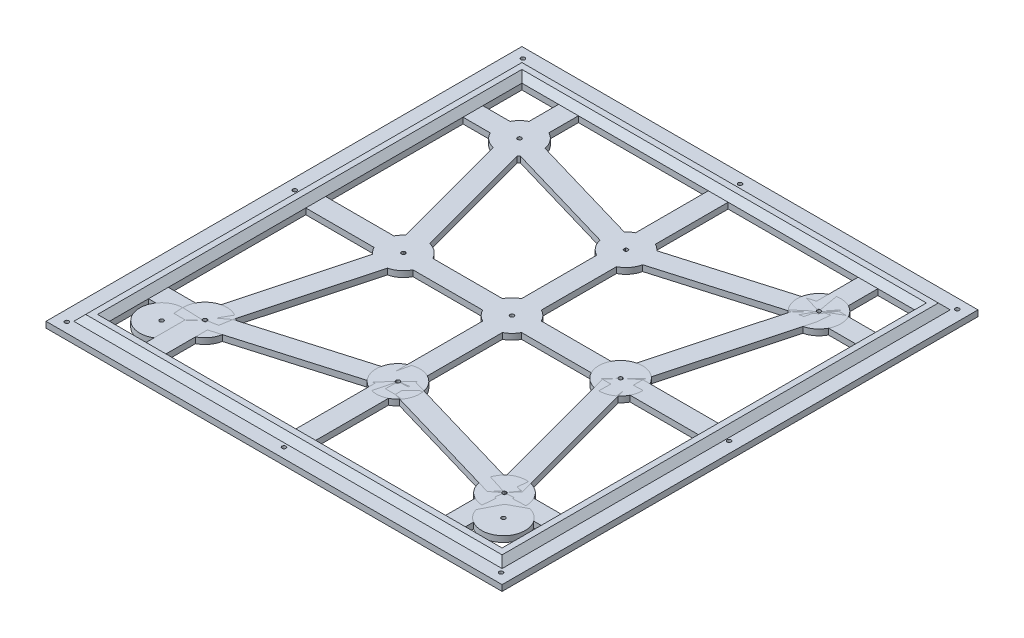
from build123d import *

# Parameters (mm, degrees)
SKETCH1_W           = 230
SKETCH1_H           = 240
BOSS_EXTRUDE1_DEPTH = 3
CUT_EXTRUDE1_REACH  = 168.235
SKETCH2_R           = 1
SKETCH4_W           = 210
SKETCH4_H           = 220
SKETCH4_W_2         = 204
SKETCH4_H_2         = 214
BOSS_EXTRUDE2_DEPTH = 3
CHAMFER1_SIZE       = 3
CUT_EXTRUDE2_REACH  = 168.235
SKETCH5_W           = 198
SKETCH5_H           = 208
SKETCH5_R           = 11
SKETCH6_W           = 43.25
SKETCH6_H           = 10
SKETCH6_W_2         = 10
SKETCH6_H_2         = 55.5
SKETCH6_W_3         = 22.491368523
SKETCH6_H_3         = 23.698697536
SKETCH6_W_4         = 52.75
SKETCH6_H_4         = 45.5
EXTRUDE_THIN2_DEPTH = 3


with BuildPart() as part:
    # Sketch1 → Boss-Extrude1 (new body)
    with BuildSketch(Plane(origin=(0, 0, 0), x_dir=(1, 0, 0), z_dir=(0, 1, 0))):
        Rectangle(SKETCH1_W, SKETCH1_H)
    extrude(amount=BOSS_EXTRUDE1_DEPTH)

    # Sketch2 → Cut-Extrude1 (cut, up to next)
    with BuildSketch(Plane(origin=(0, 3, 0), x_dir=(1, 0, 0), z_dir=(0, 1, 0)), mode=Mode.PRIVATE) as cut_extrude1_sk1:
        with Locations(Location((-109.5, -115, 0), (0, 0, 270))):
            Circle(SKETCH2_R)
    cut_extrude1_tool1 = extrude(cut_extrude1_sk1.sketch, amount=-CUT_EXTRUDE1_REACH, mode=Mode.PRIVATE) & part.part
    # Sketch2 → Cut-Extrude1 (cut, up to next)
    with BuildSketch(Plane(origin=(0, 3, 0), x_dir=(1, 0, 0), z_dir=(0, 1, 0)), mode=Mode.PRIVATE) as cut_extrude1_sk2:
        with Locations(Location((109.5, -115, 0), (0, 0, 270))):
            Circle(SKETCH2_R)
    cut_extrude1_tool2 = extrude(cut_extrude1_sk2.sketch, amount=-CUT_EXTRUDE1_REACH, mode=Mode.PRIVATE) & part.part
    # Sketch2 → Cut-Extrude1 (cut, up to next)
    with BuildSketch(Plane(origin=(0, 3, 0), x_dir=(1, 0, 0), z_dir=(0, 1, 0)), mode=Mode.PRIVATE) as cut_extrude1_sk3:
        with Locations(Location((0, -115, 0), (0, 0, 270))):
            Circle(SKETCH2_R)
    cut_extrude1_tool3 = extrude(cut_extrude1_sk3.sketch, amount=-CUT_EXTRUDE1_REACH, mode=Mode.PRIVATE) & part.part
    # Sketch2 → Cut-Extrude1 (cut, up to next)
    with BuildSketch(Plane(origin=(0, 3, 0), x_dir=(1, 0, 0), z_dir=(0, 1, 0)), mode=Mode.PRIVATE) as cut_extrude1_sk4:
        with Locations(Location((-86.197067896, -90.526600986, 0), (0, 0, 270))):
            Circle(SKETCH2_R)
    cut_extrude1_tool4 = extrude(cut_extrude1_sk4.sketch, amount=-CUT_EXTRUDE1_REACH, mode=Mode.PRIVATE) & part.part
    # Sketch2 → Cut-Extrude1 (cut, up to next)
    with BuildSketch(Plane(origin=(0, 3, 0), x_dir=(1, 0, 0), z_dir=(0, 1, 0)), mode=Mode.PRIVATE) as cut_extrude1_sk5:
        with Locations(Location((86.197067896, -90.526600986, 0), (0, 0, 270))):
            Circle(SKETCH2_R)
    cut_extrude1_tool5 = extrude(cut_extrude1_sk5.sketch, amount=-CUT_EXTRUDE1_REACH, mode=Mode.PRIVATE) & part.part
    # Sketch2 → Cut-Extrude1 (cut, up to next)
    with BuildSketch(Plane(origin=(0, 3, 0), x_dir=(1, 0, 0), z_dir=(0, 1, 0)), mode=Mode.PRIVATE) as cut_extrude1_sk6:
        with Locations(Location((0, 0, 0), (0, 0, 270))):
            Circle(SKETCH2_R)
    cut_extrude1_tool6 = extrude(cut_extrude1_sk6.sketch, amount=-CUT_EXTRUDE1_REACH, mode=Mode.PRIVATE) & part.part
    # Sketch2 → Cut-Extrude1 (cut, up to next)
    with BuildSketch(Plane(origin=(0, 3, 0), x_dir=(1, 0, 0), z_dir=(0, 1, 0)), mode=Mode.PRIVATE) as cut_extrude1_sk7:
        with Locations(Location((-109.5, 0, 0), (0, 0, 270))):
            Circle(SKETCH2_R)
    cut_extrude1_tool7 = extrude(cut_extrude1_sk7.sketch, amount=-CUT_EXTRUDE1_REACH, mode=Mode.PRIVATE) & part.part
    # Sketch2 → Cut-Extrude1 (cut, up to next)
    with BuildSketch(Plane(origin=(0, 3, 0), x_dir=(1, 0, 0), z_dir=(0, 1, 0)), mode=Mode.PRIVATE) as cut_extrude1_sk8:
        with Locations(Location((-109.5, 115, 0), (0, 0, 270))):
            Circle(SKETCH2_R)
    cut_extrude1_tool8 = extrude(cut_extrude1_sk8.sketch, amount=-CUT_EXTRUDE1_REACH, mode=Mode.PRIVATE) & part.part
    # Sketch2 → Cut-Extrude1 (cut, up to next)
    with BuildSketch(Plane(origin=(0, 3, 0), x_dir=(1, 0, 0), z_dir=(0, 1, 0)), mode=Mode.PRIVATE) as cut_extrude1_sk9:
        with Locations(Location((-75.508631477, 79.301302464, 0), (0, 0, 270))):
            Circle(SKETCH2_R)
    cut_extrude1_tool9 = extrude(cut_extrude1_sk9.sketch, amount=-CUT_EXTRUDE1_REACH, mode=Mode.PRIVATE) & part.part
    # Sketch2 → Cut-Extrude1 (cut, up to next)
    with BuildSketch(Plane(origin=(0, 3, 0), x_dir=(1, 0, 0), z_dir=(0, 1, 0)), mode=Mode.PRIVATE) as cut_extrude1_sk10:
        with Locations(Location((75.508631477, 79.301302464, 0), (0, 0, 270))):
            Circle(SKETCH2_R)
    cut_extrude1_tool10 = extrude(cut_extrude1_sk10.sketch, amount=-CUT_EXTRUDE1_REACH, mode=Mode.PRIVATE) & part.part
    # Sketch2 → Cut-Extrude1 (cut, up to next)
    with BuildSketch(Plane(origin=(0, 3, 0), x_dir=(1, 0, 0), z_dir=(0, 1, 0)), mode=Mode.PRIVATE) as cut_extrude1_sk11:
        with Locations(Location((0, 115, 0), (0, 0, 270))):
            Circle(SKETCH2_R)
    cut_extrude1_tool11 = extrude(cut_extrude1_sk11.sketch, amount=-CUT_EXTRUDE1_REACH, mode=Mode.PRIVATE) & part.part
    # Sketch2 → Cut-Extrude1 (cut, up to next)
    with BuildSketch(Plane(origin=(0, 3, 0), x_dir=(1, 0, 0), z_dir=(0, 1, 0)), mode=Mode.PRIVATE) as cut_extrude1_sk12:
        with Locations(Location((109.5, 115, 0), (0, 0, 270))):
            Circle(SKETCH2_R)
    cut_extrude1_tool12 = extrude(cut_extrude1_sk12.sketch, amount=-CUT_EXTRUDE1_REACH, mode=Mode.PRIVATE) & part.part
    # Sketch2 → Cut-Extrude1 (cut, up to next)
    with BuildSketch(Plane(origin=(0, 3, 0), x_dir=(1, 0, 0), z_dir=(0, 1, 0)), mode=Mode.PRIVATE) as cut_extrude1_sk13:
        with Locations(Location((109.5, 0, 0), (0, 0, 270))):
            Circle(SKETCH2_R)
    cut_extrude1_tool13 = extrude(cut_extrude1_sk13.sketch, amount=-CUT_EXTRUDE1_REACH, mode=Mode.PRIVATE) & part.part
    # Sketch2 → Cut-Extrude1 (cut, up to next)
    with BuildSketch(Plane(origin=(0, 3, 0), x_dir=(1, 0, 0), z_dir=(0, 1, 0)), mode=Mode.PRIVATE) as cut_extrude1_sk14:
        with Locations(Location((0, 57.5, 0), (0, 0, 270))):
            Circle(SKETCH2_R)
    cut_extrude1_tool14 = extrude(cut_extrude1_sk14.sketch, amount=-CUT_EXTRUDE1_REACH, mode=Mode.PRIVATE) & part.part
    # Sketch2 → Cut-Extrude1 (cut, up to next)
    with BuildSketch(Plane(origin=(0, 3, 0), x_dir=(1, 0, 0), z_dir=(0, 1, 0)), mode=Mode.PRIVATE) as cut_extrude1_sk15:
        with Locations(Location((0, -57.5, 0), (0, 0, 270))):
            Circle(SKETCH2_R)
    cut_extrude1_tool15 = extrude(cut_extrude1_sk15.sketch, amount=-CUT_EXTRUDE1_REACH, mode=Mode.PRIVATE) & part.part
    # Sketch2 → Cut-Extrude1 (cut, up to next)
    with BuildSketch(Plane(origin=(0, 3, 0), x_dir=(1, 0, 0), z_dir=(0, 1, 0)), mode=Mode.PRIVATE) as cut_extrude1_sk16:
        with Locations(Location((-54.75, 0, 0), (0, 0, 270))):
            Circle(SKETCH2_R)
    cut_extrude1_tool16 = extrude(cut_extrude1_sk16.sketch, amount=-CUT_EXTRUDE1_REACH, mode=Mode.PRIVATE) & part.part
    # Sketch2 → Cut-Extrude1 (cut, up to next)
    with BuildSketch(Plane(origin=(0, 3, 0), x_dir=(1, 0, 0), z_dir=(0, 1, 0)), mode=Mode.PRIVATE) as cut_extrude1_sk17:
        with Locations(Location((54.75, 0, 0), (0, 0, 270))):
            Circle(SKETCH2_R)
    cut_extrude1_tool17 = extrude(cut_extrude1_sk17.sketch, amount=-CUT_EXTRUDE1_REACH, mode=Mode.PRIVATE) & part.part
    # Sketch2 → Cut-Extrude1 (cut, up to next)
    with BuildSketch(Plane(origin=(0, 3, 0), x_dir=(1, 0, 0), z_dir=(0, 1, 0)), mode=Mode.PRIVATE) as cut_extrude1_sk18:
        with Locations(Location((-75.508631477, -79.301302464, 0), (0, 0, 270))):
            Circle(SKETCH2_R)
    cut_extrude1_tool18 = extrude(cut_extrude1_sk18.sketch, amount=-CUT_EXTRUDE1_REACH, mode=Mode.PRIVATE) & part.part
    # Sketch2 → Cut-Extrude1 (cut, up to next)
    with BuildSketch(Plane(origin=(0, 3, 0), x_dir=(1, 0, 0), z_dir=(0, 1, 0)), mode=Mode.PRIVATE) as cut_extrude1_sk19:
        with Locations(Location((75.508631477, -79.301302464, 0), (0, 0, 270))):
            Circle(SKETCH2_R)
    cut_extrude1_tool19 = extrude(cut_extrude1_sk19.sketch, amount=-CUT_EXTRUDE1_REACH, mode=Mode.PRIVATE) & part.part
    add(cut_extrude1_tool1.solids().sort_by_distance((-109.5, 3, 115))[0], mode=Mode.SUBTRACT)
    add(cut_extrude1_tool2.solids().sort_by_distance((109.5, 3, 115))[0], mode=Mode.SUBTRACT)
    add(cut_extrude1_tool3.solids().sort_by_distance((0, 3, 115))[0], mode=Mode.SUBTRACT)
    add(cut_extrude1_tool4.solids().sort_by_distance((-86.197068, 3, 90.526601))[0], mode=Mode.SUBTRACT)
    add(cut_extrude1_tool5.solids().sort_by_distance((86.197068, 3, 90.526601))[0], mode=Mode.SUBTRACT)
    add(cut_extrude1_tool6.solids().sort_by_distance((0, 3, 0))[0], mode=Mode.SUBTRACT)
    add(cut_extrude1_tool7.solids().sort_by_distance((-109.5, 3, 0))[0], mode=Mode.SUBTRACT)
    add(cut_extrude1_tool8.solids().sort_by_distance((-109.5, 3, -115))[0], mode=Mode.SUBTRACT)
    add(cut_extrude1_tool9.solids().sort_by_distance((-75.508631, 3, -79.301302))[0], mode=Mode.SUBTRACT)
    add(cut_extrude1_tool10.solids().sort_by_distance((75.508631, 3, -79.301302))[0], mode=Mode.SUBTRACT)
    add(cut_extrude1_tool11.solids().sort_by_distance((0, 3, -115))[0], mode=Mode.SUBTRACT)
    add(cut_extrude1_tool12.solids().sort_by_distance((109.5, 3, -115))[0], mode=Mode.SUBTRACT)
    add(cut_extrude1_tool13.solids().sort_by_distance((109.5, 3, 0))[0], mode=Mode.SUBTRACT)
    add(cut_extrude1_tool14.solids().sort_by_distance((0, 3, -57.5))[0], mode=Mode.SUBTRACT)
    add(cut_extrude1_tool15.solids().sort_by_distance((0, 3, 57.5))[0], mode=Mode.SUBTRACT)
    add(cut_extrude1_tool16.solids().sort_by_distance((-54.75, 3, 0))[0], mode=Mode.SUBTRACT)
    add(cut_extrude1_tool17.solids().sort_by_distance((54.75, 3, 0))[0], mode=Mode.SUBTRACT)
    add(cut_extrude1_tool18.solids().sort_by_distance((-75.508631, 3, 79.301302))[0], mode=Mode.SUBTRACT)
    add(cut_extrude1_tool19.solids().sort_by_distance((75.508631, 3, 79.301302))[0], mode=Mode.SUBTRACT)

    # Sketch4 → Boss-Extrude2 (add)
    with BuildSketch(Plane(origin=(0, 3, 0), x_dir=(1, 0, 0), z_dir=(0, 1, 0))):
        Rectangle(SKETCH4_W, SKETCH4_H)
        Rectangle(SKETCH4_W_2, SKETCH4_H_2, mode=Mode.SUBTRACT)
    extrude(amount=BOSS_EXTRUDE2_DEPTH)

    # Chamfer1
    chamfer1_edges = [part.edges().sort_by_distance(p)[0] for p in [
        (0, 3, -110),
        (105, 3, 0),
        (0, 3, 110),
        (-105, 3, 0),
        (0, 3, -107),
        (102, 3, 0),
        (0, 3, 107),
        (-102, 3, 0),
    ]]
    chamfer(chamfer1_edges, length=CHAMFER1_SIZE - 0.0001)  # a hair under: the kernel refuses the full size

    # Sketch5 → Cut-Extrude2 (cut, up to next)
    with BuildSketch(Plane(origin=(0, 3, 0), x_dir=(1, 0, 0), z_dir=(0, 1, 0)), mode=Mode.PRIVATE) as cut_extrude2_sk1:
        Rectangle(SKETCH5_W, SKETCH5_H)
        with BuildLine():
            ThreePointArc((-75.199465267, -90.29695689), (-75.197667255, -90.411772682), (-75.197067896, -90.526600986))
            ThreePointArc((-75.197067896, -90.526600986), (-93.865156696, -98.413324904), (-86.506234106, -79.530946561))
            ThreePointArc((-86.506234106, -79.530946561), (-75.623459782, -68.301901823), (-64.508631477, -79.301302464))
            ThreePointArc((-64.508631477, -79.301302464), (-67.621907559, -86.969391264), (-75.199465267, -90.29695689))
        make_face(mode=Mode.SUBTRACT)
        with Locations(Location((0, -57.5, 0), (0, 0, 270))):
            Circle(SKETCH5_R, mode=Mode.SUBTRACT)
        with BuildLine():
            ThreePointArc((86.506234106, -79.530946561), (94.083791814, -82.858512186), (97.197067896, -90.526600986))
            ThreePointArc((97.197067896, -90.526600986), (86.082239591, -101.526001627), (75.199465267, -90.29695689))
            ThreePointArc((75.199465267, -90.29695689), (67.840542677, -71.414578546), (86.508631477, -79.301302464))
            ThreePointArc((86.508631477, -79.301302464), (86.508032118, -79.416130769), (86.506234106, -79.530946561))
        make_face(mode=Mode.SUBTRACT)
        with Locations(Location((-54.75, 0, 0), (0, 0, 270))):
            Circle(SKETCH5_R, mode=Mode.SUBTRACT)
        with Locations(Location((-75.508631477, 79.301302464, 0), (0, 0, 270))):
            Circle(SKETCH5_R, mode=Mode.SUBTRACT)
        with Locations(Location((0, 0, 0), (0, 0, 270))):
            Circle(SKETCH5_R, mode=Mode.SUBTRACT)
        with Locations(Location((54.75, 0, 0), (0, 0, 270))):
            Circle(SKETCH5_R, mode=Mode.SUBTRACT)
        with Locations(Location((0, 57.5, 0), (0, 0, 270))):
            Circle(SKETCH5_R, mode=Mode.SUBTRACT)
        with Locations(Location((75.508631477, 79.301302464, 0), (0, 0, 270))):
            Circle(SKETCH5_R, mode=Mode.SUBTRACT)
    cut_extrude2_tool1 = extrude(cut_extrude2_sk1.sketch, amount=-CUT_EXTRUDE2_REACH, mode=Mode.PRIVATE) & part.part
    add(cut_extrude2_tool1.solids().sort_by_distance((0, 3, 101.128276))[0], mode=Mode.SUBTRACT)


with BuildPart() as cut_extrude2_piece_1:
    # of the separate pieces the step leaves, piece 1, a body of its own (cut_extrude2_pieces)
    add(part.part.solids().sort_by_distance((107.9999, 3, -112.9999))[0])


with BuildPart() as cut_extrude2_piece_2:
    # of the separate pieces the step leaves, piece 2, a body of its own (cut_extrude2_pieces)
    add(part.part.solids().sort_by_distance((75.199465267, 0, 90.29695689))[0])


with BuildPart() as cut_extrude2_piece_3:
    # of the separate pieces the step leaves, piece 3, a body of its own (cut_extrude2_pieces)
    add(part.part.solids().sort_by_distance((-64.508631477, 0, 79.301302464))[0])


with BuildPart() as cut_extrude2_piece_4:
    # of the separate pieces the step leaves, piece 4, a body of its own (cut_extrude2_pieces)
    add(part.part.solids().sort_by_distance((0, 0, 68.5))[0])


with BuildPart() as cut_extrude2_piece_5:
    # of the separate pieces the step leaves, piece 5, a body of its own (cut_extrude2_pieces)
    add(part.part.solids().sort_by_distance((0, 0, -46.5))[0])


with BuildPart() as cut_extrude2_piece_6:
    # of the separate pieces the step leaves, piece 6, a body of its own (cut_extrude2_pieces)
    add(part.part.solids().sort_by_distance((0, 0, 11))[0])


with BuildPart() as cut_extrude2_piece_7:
    # of the separate pieces the step leaves, piece 7, a body of its own (cut_extrude2_pieces)
    add(part.part.solids().sort_by_distance((75.508631477, 0, -68.301302464))[0])


with BuildPart() as cut_extrude2_piece_8:
    # of the separate pieces the step leaves, piece 8, a body of its own (cut_extrude2_pieces)
    add(part.part.solids().sort_by_distance((-75.508631477, 0, -68.301302464))[0])


with BuildPart() as cut_extrude2_piece_9:
    # of the separate pieces the step leaves, piece 9, a body of its own (cut_extrude2_pieces)
    add(part.part.solids().sort_by_distance((54.75, 0, 11))[0])


with BuildPart() as cut_extrude2_piece_10:
    # of the separate pieces the step leaves, piece 10, a body of its own (cut_extrude2_pieces)
    add(part.part.solids().sort_by_distance((-54.75, 0, 11))[0])


    add(cut_extrude2_piece_1.part)  # Extrude-Thin2 merges Cut-Extrude2 piece 1

    add(cut_extrude2_piece_8.part)  # Extrude-Thin2 merges Cut-Extrude2 piece 8

    add(cut_extrude2_piece_5.part)  # Extrude-Thin2 merges Cut-Extrude2 piece 5

    add(cut_extrude2_piece_6.part)  # Extrude-Thin2 merges Cut-Extrude2 piece 6
    # Sketch6 → Extrude-Thin2 (add)
    with BuildSketch(Plane(origin=(0, 3, 0), x_dir=(1, 0, 0), z_dir=(0, 1, 0))):
        with Locations((-77.375, 0)):
            Rectangle(SKETCH6_W, SKETCH6_H)
        Polygon((-75.953004658, 74.22168314), (-2.404131775, 52.701207031), (0.404131775, 62.298792969), (-73.144741108, 83.819269078), align=None)
        Polygon((-80.337544449, 77.004537447), (-59.578912972, -0.296765017), (-49.921087028, 2.296765017), (-70.679718505, 79.598067481), align=None)
        with Locations((0, 28.75)):
            Rectangle(SKETCH6_W_2, SKETCH6_H_2)
        with Locations((-87.754315738, 79.301302464)):
            Rectangle(SKETCH6_W_3, SKETCH6_H)
        with Locations((-75.508631477, 92.150651232)):
            Rectangle(SKETCH6_W_2, SKETCH6_H_3)
        with Locations((27.375, 0)):
            Rectangle(SKETCH6_W_4, SKETCH6_H)
        with Locations((75.508631477, 92.150651232)):
            Rectangle(SKETCH6_W_2, SKETCH6_H_3)
        with Locations((87.754315738, 79.301302464)):
            Rectangle(SKETCH6_W_3, SKETCH6_H)
        Polygon((70.679718505, 79.598067481), (49.921087028, 2.296765017), (59.578912972, -0.296765017), (80.337544449, 77.004537447), align=None)
        Polygon((73.144741108, 83.819269078), (-0.404131775, 62.298792969), (2.404131775, 52.701207031), (75.953004658, 74.22168314), align=None)
        with Locations((0, 81.25)):
            Rectangle(SKETCH6_W_2, SKETCH6_H_4)
        with Locations((77.375, 0)):
            Rectangle(SKETCH6_W, SKETCH6_H)
        with Locations((-27.375, 0)):
            Rectangle(SKETCH6_W_4, SKETCH6_H)
        with Locations((0, -81.25)):
            Rectangle(SKETCH6_W_2, SKETCH6_H_4)
        Polygon((75.953004658, -74.22168314), (2.404131775, -52.701207031), (-0.404131775, -62.298792969), (73.144741108, -83.819269078), align=None)
        Polygon((80.337544449, -77.004537447), (59.578912972, 0.296765017), (49.921087028, -2.296765017), (70.679718505, -79.598067481), align=None)
        with Locations((87.754315738, -79.301302464)):
            Rectangle(SKETCH6_W_3, SKETCH6_H)
        with Locations((75.508631477, -92.150651232)):
            Rectangle(SKETCH6_W_2, SKETCH6_H_3)
        with Locations((-75.508631477, -92.150651232)):
            Rectangle(SKETCH6_W_2, SKETCH6_H_3)
        with Locations((-87.754315738, -79.301302464)):
            Rectangle(SKETCH6_W_3, SKETCH6_H)
        with Locations((0, -28.75)):
            Rectangle(SKETCH6_W_2, SKETCH6_H_2)
        Polygon((-70.679718505, -79.598067481), (-49.921087028, -2.296765017), (-59.578912972, 0.296765017), (-80.337544449, -77.004537447), align=None)
        Polygon((-73.144741108, -83.819269078), (0.404131775, -62.298792969), (-2.404131775, -52.701207031), (-75.953004658, -74.22168314), align=None)
    extrude(amount=-EXTRUDE_THIN2_DEPTH)


solid = Compound([cut_extrude2_piece_2.part, cut_extrude2_piece_3.part, cut_extrude2_piece_4.part, cut_extrude2_piece_7.part, cut_extrude2_piece_9.part, cut_extrude2_piece_10.part])
